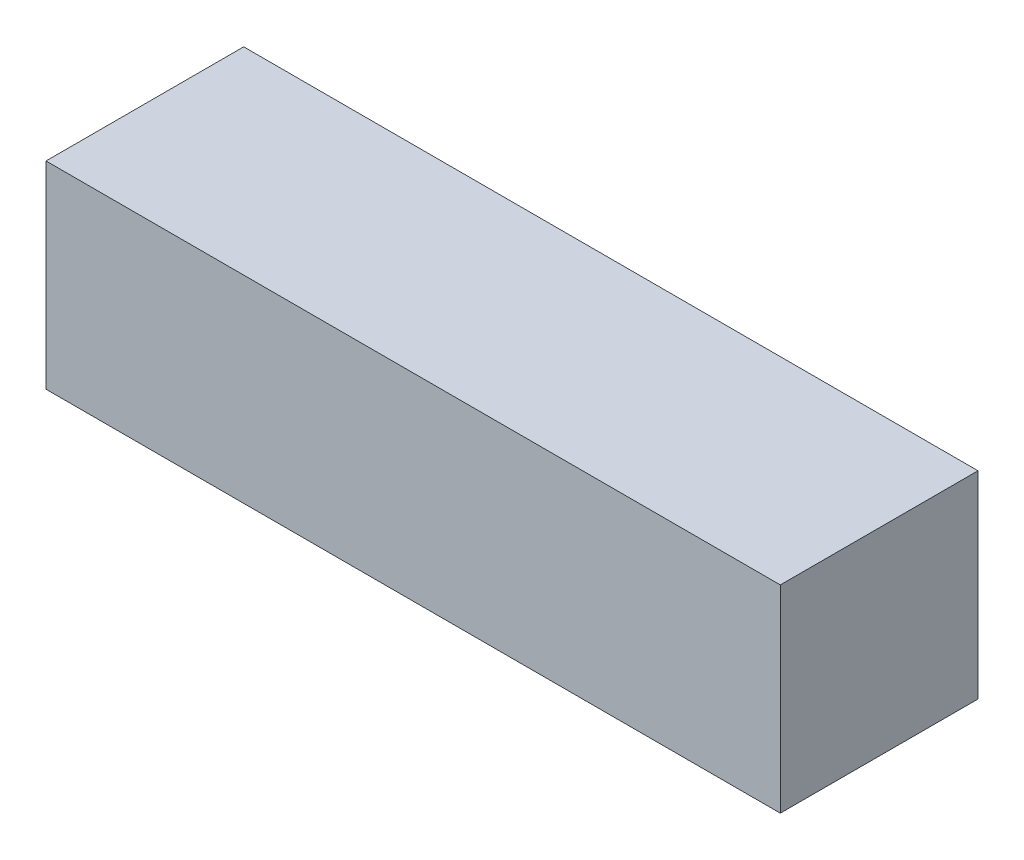
from build123d import *

# Parameters (mm, degrees)
SKETCH_1_W      = 260
SKETCH_1_H      = 70
EXTRUDE_1_DEPTH = 70


with BuildPart() as part:
    # 草图1 → 凸台-拉伸1 (new body)
    with BuildSketch(Plane.XY):
        Rectangle(SKETCH_1_W, SKETCH_1_H)
    extrude(amount=EXTRUDE_1_DEPTH)


solid = part.part
